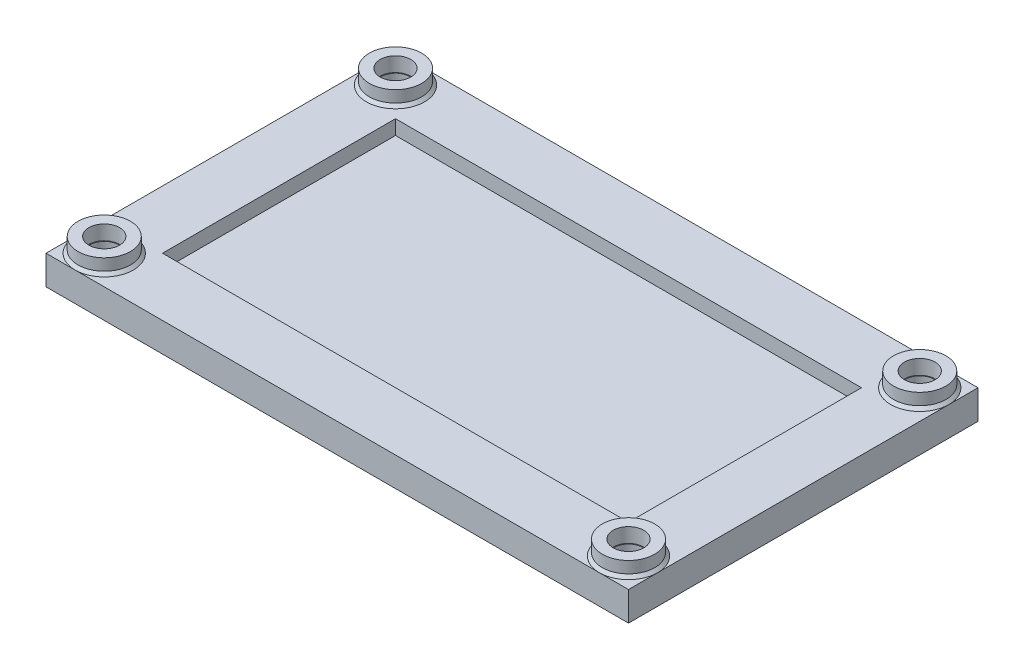
from build123d import *

# Parameters (mm, degrees)
SKETCH1_W           = 200
SKETCH1_H           = 120
BOSS_EXTRUDE3_DEPTH = 10
SKETCH3_R           = 5
SKETCH3_W           = 160
SKETCH3_H           = 80
CUT_EXTRUDE2_DEPTH  = 5
SKETCH6_R           = 9
SKETCH6_R_2         = 5.25
BOSS_EXTRUDE4_DEPTH = 10
CHAMFER1_SIZE       = 1


with BuildPart() as part:
    # Sketch1 → Boss-Extrude3 (new body)
    with BuildSketch(Plane(origin=(0, 0, 0), x_dir=(1, 0, 0), z_dir=(0, 1, 0))):
        Rectangle(SKETCH1_W, SKETCH1_H)
    extrude(amount=BOSS_EXTRUDE3_DEPTH)

    # Sketch3 → Cut-Extrude2 (cut)
    with BuildSketch(Plane(origin=(0, 10, 0), x_dir=(1, 0, 0), z_dir=(0, 1, 0))):
        with Locations(Location((-90, 50, 0), (0, 0, 270))):
            Circle(SKETCH3_R)
        with Locations(Location((90, -50, 0), (0, 0, 270))):
            Circle(SKETCH3_R)
        with Locations(Location((90, 50, 0), (0, 0, 270))):
            Circle(SKETCH3_R)
        with Locations(Location((-90, -50, 0), (0, 0, 270))):
            Circle(SKETCH3_R)
        Rectangle(SKETCH3_W, SKETCH3_H)
    extrude(amount=-CUT_EXTRUDE2_DEPTH, mode=Mode.SUBTRACT)

    # Sketch6 → Boss-Extrude4 (add)
    # profile 1 of 4: a face of its own
    with BuildSketch(Plane(origin=(0, 5, 0), x_dir=(1, 0, 0), z_dir=(0, 1, 0))):
        with Locations(Location((-90, 50, 0), (0, 0, 270))):
            Circle(SKETCH6_R)
        with Locations(Location((-90, 50, 0), (0, 0, 270))):
            Circle(SKETCH6_R_2, mode=Mode.SUBTRACT)
    # profile 2 of 4: a face of its own
    with BuildSketch(Plane(origin=(0, 5, 0), x_dir=(1, 0, 0), z_dir=(0, 1, 0))):
        with Locations(Location((90, 50, 0), (0, 0, 270))):
            Circle(SKETCH6_R)
        with Locations(Location((90, 50, 0), (0, 0, 270))):
            Circle(SKETCH6_R_2, mode=Mode.SUBTRACT)
    # profile 3 of 4: a face of its own
    with BuildSketch(Plane(origin=(0, 5, 0), x_dir=(1, 0, 0), z_dir=(0, 1, 0))):
        with Locations(Location((90, -50, 0), (0, 0, 270))):
            Circle(SKETCH6_R)
        with Locations(Location((90, -50, 0), (0, 0, 270))):
            Circle(SKETCH6_R_2, mode=Mode.SUBTRACT)
    # profile 4 of 4: a face of its own
    with BuildSketch(Plane(origin=(0, 5, 0), x_dir=(1, 0, 0), z_dir=(0, 1, 0))):
        with Locations(Location((-90, -50, 0), (0, 0, 270))):
            Circle(SKETCH6_R)
        with Locations(Location((-90, -50, 0), (0, 0, 270))):
            Circle(SKETCH6_R_2, mode=Mode.SUBTRACT)
    extrude(amount=BOSS_EXTRUDE4_DEPTH)

    # Chamfer1
    chamfer1_edges = [part.edges().sort_by_distance(p)[0] for p in [
        (-90, 10, -59),
        (90, 10, -59),
        (90, 10, 41),
        (-90, 10, 41),
    ]]
    chamfer(chamfer1_edges, length=CHAMFER1_SIZE - 0.0001)  # a hair under: the kernel refuses the full size


solid = part.part
